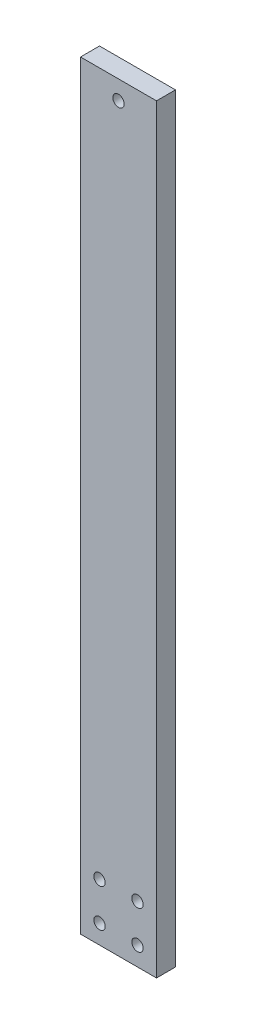
from build123d import *

# Parameters (mm, degrees)
SKETCH1_W           = 20
SKETCH1_H           = 200
BOSS_EXTRUDE1_DEPTH = 5
SKETCH2_R           = 1.5
CUT_EXTRUDE1_DEPTH  = 101.623058987
SKETCH3_R           = 1.5
CUT_EXTRUDE2_DEPTH  = 101.623058987


with BuildPart() as part:
    # Sketch1 → Boss-Extrude1 (new body)
    with BuildSketch(Plane.XY):
        Rectangle(SKETCH1_W, SKETCH1_H)
    extrude(amount=BOSS_EXTRUDE1_DEPTH)

    # Sketch2 → Cut-Extrude1 (cut, through all)
    with BuildSketch(Plane.XY.offset(5)):
        with Locations((-5, -95)):
            Circle(SKETCH2_R)
        with Locations((5, -95)):
            Circle(SKETCH2_R)
        with Locations((-5, -85)):
            Circle(SKETCH2_R)
        with Locations((5, -85)):
            Circle(SKETCH2_R)
    extrude(amount=-CUT_EXTRUDE1_DEPTH, mode=Mode.SUBTRACT)

    # Sketch3 → Cut-Extrude2 (cut, through all)
    with BuildSketch(Plane.XY.offset(5)):
        with Locations((0, 95)):
            Circle(SKETCH3_R)
    extrude(amount=-CUT_EXTRUDE2_DEPTH, mode=Mode.SUBTRACT)


solid = part.part
